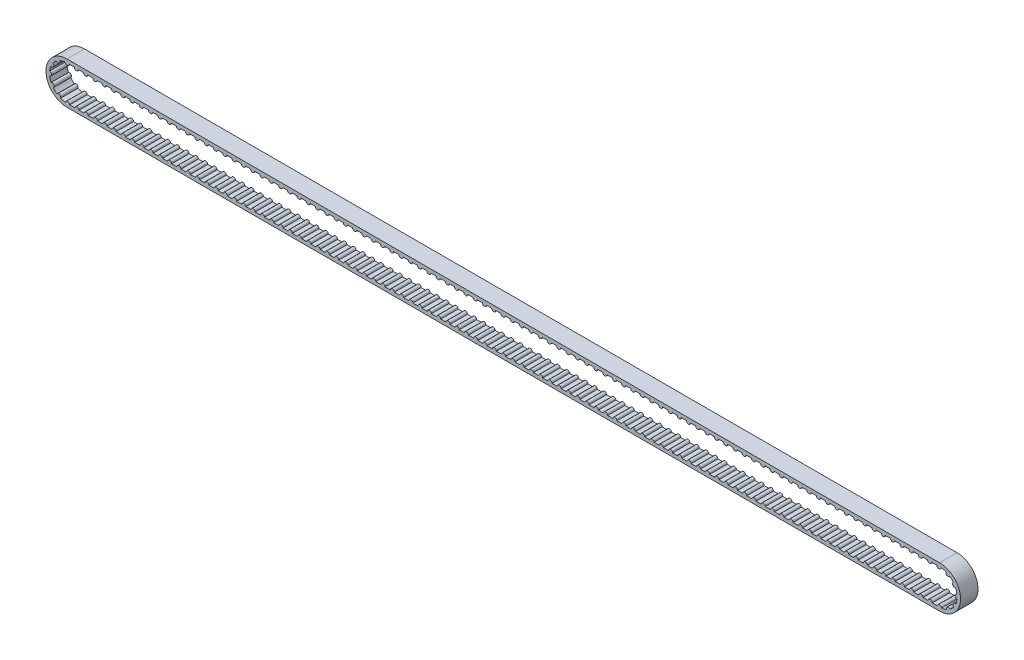
from build123d import *

# Parameters (mm, degrees)
BOSS_EXTRUDE2_DEPTH = 6
BOSS_EXTRUDE4_DEPTH = 6
CRVPATTERN7_DEPTH   = 6


# Read off the part's stored shape, not the designer's step: CrvPattern7
with BuildPart() as part:
    # Sketch1 → Boss-Extrude2 (new body)
    with BuildSketch(Plane.XY):
        with BuildLine():
            Line((0, 7.2), (300, 7.2))
            ThreePointArc((300, 7.2), (307.2, 0), (300, -7.2))
            Line((300, -7.2), (0, -7.2))
            ThreePointArc((0, -7.2), (-7.2, 0), (0, 7.2))
        make_face()
        with BuildLine():
            Line((0, 6), (300, 6))
            ThreePointArc((300, 6), (306, 0), (300, -6))
            Line((300, -6), (0, -6))
            ThreePointArc((0, -6), (-6, 0), (0, 6))
        make_face(mode=Mode.SUBTRACT)
    extrude(amount=BOSS_EXTRUDE2_DEPTH)

    # Sketch4 → Boss-Extrude4 (add)
    with BuildSketch(Plane.XY.offset(6)):
        with BuildLine():
            Line((50.349238174, 6), (51.749238174, 6))
            ThreePointArc((51.749238174, 6), (51.049238174, 5.3), (50.349238174, 6))
        make_face()
    extrude(amount=-BOSS_EXTRUDE4_DEPTH)

    # CrvPattern7 outline → CrvPattern7 (add)
    with BuildSketch(Plane.XY):
        with BuildLine():
            Line((54.937733733, 6), (53.537733733, 6))
            ThreePointArc((53.537733733, 6), (54.237733733, 5.3), (54.937733733, 6))
        make_face()
        with BuildLine():
            Line((48.560742615, 6), (47.160742615, 6))
            ThreePointArc((47.160742615, 6), (47.860742615, 5.3), (48.560742615, 6))
        make_face()
        with BuildLine():
            Line((45.372247055, 6), (43.972247055, 6))
            ThreePointArc((43.972247055, 6), (44.672247055, 5.3), (45.372247055, 6))
        make_face()
        with BuildLine():
            Line((42.183751496, 6), (40.783751496, 6))
            ThreePointArc((40.783751496, 6), (41.483751496, 5.3), (42.183751496, 6))
        make_face()
        with BuildLine():
            Line((38.995255937, 6), (37.595255937, 6))
            ThreePointArc((37.595255937, 6), (38.295255937, 5.3), (38.995255937, 6))
        make_face()
        with BuildLine():
            Line((35.806760378, 6), (34.406760378, 6))
            ThreePointArc((34.406760378, 6), (35.106760378, 5.3), (35.806760378, 6))
        make_face()
        with BuildLine():
            Line((32.618264819, 6), (31.218264819, 6))
            ThreePointArc((31.218264819, 6), (31.918264819, 5.3), (32.618264819, 6))
        make_face()
        with BuildLine():
            Line((29.429769259, 6), (28.029769259, 6))
            ThreePointArc((28.029769259, 6), (28.729769259, 5.3), (29.429769259, 6))
        make_face()
        with BuildLine():
            Line((26.2412737, 6), (24.8412737, 6))
            ThreePointArc((24.8412737, 6), (25.5412737, 5.3), (26.2412737, 6))
        make_face()
        with BuildLine():
            Line((23.052778141, 6), (21.652778141, 6))
            ThreePointArc((21.652778141, 6), (22.352778141, 5.3), (23.052778141, 6))
        make_face()
        with BuildLine():
            Line((19.864282582, 6), (18.464282582, 6))
            ThreePointArc((18.464282582, 6), (19.164282582, 5.3), (19.864282582, 6))
        make_face()
        with BuildLine():
            Line((16.675787022, 6), (15.275787022, 6))
            ThreePointArc((15.275787022, 6), (15.975787022, 5.3), (16.675787022, 6))
        make_face()
        with BuildLine():
            Line((13.487291463, 6), (12.087291463, 6))
            ThreePointArc((12.087291463, 6), (12.787291463, 5.3), (13.487291463, 6))
        make_face()
        with BuildLine():
            Line((10.298795904, 6), (8.898795904, 6))
            ThreePointArc((8.898795904, 6), (9.598795904, 5.3), (10.298795904, 6))
        make_face()
        with BuildLine():
            Line((7.110300345, 6), (5.710300345, 6))
            ThreePointArc((5.710300345, 6), (6.410300345, 5.3), (7.110300345, 6))
        make_face()
        with BuildLine():
            Line((3.921804786, 6), (2.521804786, 6))
            ThreePointArc((2.521804786, 6), (3.221804786, 5.3), (3.921804786, 6))
        make_face()
        with BuildLine():
            ThreePointArc((0, 6), (-0.333369891, 5.990731551), (-0.665709841, 5.962954839))
            ThreePointArc((-0.665709841, 5.962954839), (0.051838299, 5.300245276), (0.733309226, 6))
            Line((0.733309226, 6), (0, 6))
        make_face()
        with BuildLine():
            ThreePointArc((-2.386875705, 5.504800121), (-3.011764762, 5.189342253), (-3.595660354, 4.803251671))
            ThreePointArc((-3.595660354, 4.803251671), (-2.660392206, 4.58391899), (-2.386875705, 5.504800121))
        make_face()
        with BuildLine():
            ThreePointArc((-4.847284913, 3.536075363), (-5.226136079, 2.947456816), (-5.533853726, 2.318720107))
            ThreePointArc((-5.533853726, 2.318720107), (-4.616420203, 2.603586855), (-4.847284913, 3.536075363))
        make_face()
        with BuildLine():
            ThreePointArc((-5.970719949, 0.592033183), (-5.999038805, -0.107393756), (-5.945704077, -0.805358946))
            ThreePointArc((-5.945704077, -0.805358946), (-5.299150944, -0.094864484), (-5.970719949, 0.592033183))
        make_face()
        with BuildLine():
            ThreePointArc((-5.447315879, -2.515303107), (-5.11729154, -3.132623069), (-4.717615178, -3.707304551))
            ThreePointArc((-4.717615178, -3.707304551), (-4.520274194, -2.767150378), (-5.447315879, -2.515303107))
        make_face()
        with BuildLine():
            ThreePointArc((-3.421437585, -4.928870545), (-2.824097096, -5.293814843), (-2.188317508, -5.586704439))
            ThreePointArc((-2.188317508, -5.586704439), (-2.494619101, -4.676203111), (-3.421437585, -4.928870545))
        make_face()
        with BuildLine():
            Line((0, -6), (0.948108207, -6))
            ThreePointArc((0.948108207, -6), (0.25662171, -5.300051773), (-0.451684708, -5.982974254))
            ThreePointArc((-0.451684708, -5.982974254), (-0.226002739, -5.995742053), (0, -6))
        make_face()
        with BuildLine():
            Line((2.736603767, -6), (4.136603767, -6))
            ThreePointArc((4.136603767, -6), (3.436603767, -5.3), (2.736603767, -6))
        make_face()
        with BuildLine():
            Line((5.925099326, -6), (7.325099326, -6))
            ThreePointArc((7.325099326, -6), (6.625099326, -5.3), (5.925099326, -6))
        make_face()
        with BuildLine():
            Line((9.113594885, -6), (10.513594885, -6))
            ThreePointArc((10.513594885, -6), (9.813594885, -5.3), (9.113594885, -6))
        make_face()
        with BuildLine():
            Line((12.302090444, -6), (13.702090444, -6))
            ThreePointArc((13.702090444, -6), (13.002090444, -5.3), (12.302090444, -6))
        make_face()
        with BuildLine():
            Line((15.490586003, -6), (16.890586003, -6))
            ThreePointArc((16.890586003, -6), (16.190586003, -5.3), (15.490586003, -6))
        make_face()
        with BuildLine():
            Line((18.679081563, -6), (20.079081563, -6))
            ThreePointArc((20.079081563, -6), (19.379081563, -5.3), (18.679081563, -6))
        make_face()
        with BuildLine():
            Line((21.867577122, -6), (23.267577122, -6))
            ThreePointArc((23.267577122, -6), (22.567577122, -5.3), (21.867577122, -6))
        make_face()
        with BuildLine():
            Line((25.056072681, -6), (26.456072681, -6))
            ThreePointArc((26.456072681, -6), (25.756072681, -5.3), (25.056072681, -6))
        make_face()
        with BuildLine():
            Line((28.24456824, -6), (29.64456824, -6))
            ThreePointArc((29.64456824, -6), (28.94456824, -5.3), (28.24456824, -6))
        make_face()
        with BuildLine():
            Line((31.4330638, -6), (32.8330638, -6))
            ThreePointArc((32.8330638, -6), (32.1330638, -5.3), (31.4330638, -6))
        make_face()
        with BuildLine():
            Line((34.621559359, -6), (36.021559359, -6))
            ThreePointArc((36.021559359, -6), (35.321559359, -5.3), (34.621559359, -6))
        make_face()
        with BuildLine():
            Line((37.810054918, -6), (39.210054918, -6))
            ThreePointArc((39.210054918, -6), (38.510054918, -5.3), (37.810054918, -6))
        make_face()
        with BuildLine():
            Line((40.998550477, -6), (42.398550477, -6))
            ThreePointArc((42.398550477, -6), (41.698550477, -5.3), (40.998550477, -6))
        make_face()
        with BuildLine():
            Line((44.187046036, -6), (45.587046036, -6))
            ThreePointArc((45.587046036, -6), (44.887046036, -5.3), (44.187046036, -6))
        make_face()
        with BuildLine():
            Line((47.375541596, -6), (48.775541596, -6))
            ThreePointArc((48.775541596, -6), (48.075541596, -5.3), (47.375541596, -6))
        make_face()
        with BuildLine():
            Line((50.564037155, -6), (51.964037155, -6))
            ThreePointArc((51.964037155, -6), (51.264037155, -5.3), (50.564037155, -6))
        make_face()
        with BuildLine():
            Line((53.752532714, -6), (55.152532714, -6))
            ThreePointArc((55.152532714, -6), (54.452532714, -5.3), (53.752532714, -6))
        make_face()
        with BuildLine():
            Line((56.941028273, -6), (58.341028273, -6))
            ThreePointArc((58.341028273, -6), (57.641028273, -5.3), (56.941028273, -6))
        make_face()
        with BuildLine():
            Line((60.129523832, -6), (61.529523832, -6))
            ThreePointArc((61.529523832, -6), (60.829523832, -5.3), (60.129523832, -6))
        make_face()
        with BuildLine():
            Line((63.318019392, -6), (64.718019392, -6))
            ThreePointArc((64.718019392, -6), (64.018019392, -5.3), (63.318019392, -6))
        make_face()
        with BuildLine():
            Line((66.506514951, -6), (67.906514951, -6))
            ThreePointArc((67.906514951, -6), (67.206514951, -5.3), (66.506514951, -6))
        make_face()
        with BuildLine():
            Line((69.69501051, -6), (71.09501051, -6))
            ThreePointArc((71.09501051, -6), (70.39501051, -5.3), (69.69501051, -6))
        make_face()
        with BuildLine():
            Line((72.883506069, -6), (74.283506069, -6))
            ThreePointArc((74.283506069, -6), (73.583506069, -5.3), (72.883506069, -6))
        make_face()
        with BuildLine():
            Line((76.072001629, -6), (77.472001629, -6))
            ThreePointArc((77.472001629, -6), (76.772001629, -5.3), (76.072001629, -6))
        make_face()
        with BuildLine():
            Line((79.260497188, -6), (80.660497188, -6))
            ThreePointArc((80.660497188, -6), (79.960497188, -5.3), (79.260497188, -6))
        make_face()
        with BuildLine():
            Line((82.448992747, -6), (83.848992747, -6))
            ThreePointArc((83.848992747, -6), (83.148992747, -5.3), (82.448992747, -6))
        make_face()
        with BuildLine():
            Line((85.637488306, -6), (87.037488306, -6))
            ThreePointArc((87.037488306, -6), (86.337488306, -5.3), (85.637488306, -6))
        make_face()
        with BuildLine():
            Line((88.825983865, -6), (90.225983865, -6))
            ThreePointArc((90.225983865, -6), (89.525983865, -5.3), (88.825983865, -6))
        make_face()
        with BuildLine():
            Line((92.014479425, -6), (93.414479425, -6))
            ThreePointArc((93.414479425, -6), (92.714479425, -5.3), (92.014479425, -6))
        make_face()
        with BuildLine():
            Line((95.202974984, -6), (96.602974984, -6))
            ThreePointArc((96.602974984, -6), (95.902974984, -5.3), (95.202974984, -6))
        make_face()
        with BuildLine():
            Line((98.391470543, -6), (99.791470543, -6))
            ThreePointArc((99.791470543, -6), (99.091470543, -5.3), (98.391470543, -6))
        make_face()
        with BuildLine():
            Line((101.579966102, -6), (102.979966102, -6))
            ThreePointArc((102.979966102, -6), (102.279966102, -5.3), (101.579966102, -6))
        make_face()
        with BuildLine():
            Line((104.768461661, -6), (106.168461661, -6))
            ThreePointArc((106.168461661, -6), (105.468461661, -5.3), (104.768461661, -6))
        make_face()
        with BuildLine():
            Line((107.956957221, -6), (109.356957221, -6))
            ThreePointArc((109.356957221, -6), (108.656957221, -5.3), (107.956957221, -6))
        make_face()
        with BuildLine():
            Line((111.14545278, -6), (112.54545278, -6))
            ThreePointArc((112.54545278, -6), (111.84545278, -5.3), (111.14545278, -6))
        make_face()
        with BuildLine():
            Line((114.333948339, -6), (115.733948339, -6))
            ThreePointArc((115.733948339, -6), (115.033948339, -5.3), (114.333948339, -6))
        make_face()
        with BuildLine():
            Line((117.522443898, -6), (118.922443898, -6))
            ThreePointArc((118.922443898, -6), (118.222443898, -5.3), (117.522443898, -6))
        make_face()
        with BuildLine():
            Line((120.710939458, -6), (122.110939458, -6))
            ThreePointArc((122.110939458, -6), (121.410939458, -5.3), (120.710939458, -6))
        make_face()
        with BuildLine():
            Line((123.899435017, -6), (125.299435017, -6))
            ThreePointArc((125.299435017, -6), (124.599435017, -5.3), (123.899435017, -6))
        make_face()
        with BuildLine():
            Line((127.087930576, -6), (128.487930576, -6))
            ThreePointArc((128.487930576, -6), (127.787930576, -5.3), (127.087930576, -6))
        make_face()
        with BuildLine():
            Line((130.276426135, -6), (131.676426135, -6))
            ThreePointArc((131.676426135, -6), (130.976426135, -5.3), (130.276426135, -6))
        make_face()
        with BuildLine():
            Line((133.464921694, -6), (134.864921694, -6))
            ThreePointArc((134.864921694, -6), (134.164921694, -5.3), (133.464921694, -6))
        make_face()
        with BuildLine():
            Line((136.653417254, -6), (138.053417254, -6))
            ThreePointArc((138.053417254, -6), (137.353417254, -5.3), (136.653417254, -6))
        make_face()
        with BuildLine():
            Line((139.841912813, -6), (141.241912813, -6))
            ThreePointArc((141.241912813, -6), (140.541912813, -5.3), (139.841912813, -6))
        make_face()
        with BuildLine():
            Line((143.030408372, -6), (144.430408372, -6))
            ThreePointArc((144.430408372, -6), (143.730408372, -5.3), (143.030408372, -6))
        make_face()
        with BuildLine():
            Line((146.218903931, -6), (147.618903931, -6))
            ThreePointArc((147.618903931, -6), (146.918903931, -5.3), (146.218903931, -6))
        make_face()
        with BuildLine():
            Line((149.407399491, -6), (150.807399491, -6))
            ThreePointArc((150.807399491, -6), (150.107399491, -5.3), (149.407399491, -6))
        make_face()
        with BuildLine():
            Line((152.59589505, -6), (153.99589505, -6))
            ThreePointArc((153.99589505, -6), (153.29589505, -5.3), (152.59589505, -6))
        make_face()
        with BuildLine():
            Line((155.784390609, -6), (157.184390609, -6))
            ThreePointArc((157.184390609, -6), (156.484390609, -5.3), (155.784390609, -6))
        make_face()
        with BuildLine():
            Line((158.972886168, -6), (160.372886168, -6))
            ThreePointArc((160.372886168, -6), (159.672886168, -5.3), (158.972886168, -6))
        make_face()
        with BuildLine():
            Line((162.161381727, -6), (163.561381727, -6))
            ThreePointArc((163.561381727, -6), (162.861381727, -5.3), (162.161381727, -6))
        make_face()
        with BuildLine():
            Line((165.349877287, -6), (166.749877287, -6))
            ThreePointArc((166.749877287, -6), (166.049877287, -5.3), (165.349877287, -6))
        make_face()
        with BuildLine():
            Line((168.538372846, -6), (169.938372846, -6))
            ThreePointArc((169.938372846, -6), (169.238372846, -5.3), (168.538372846, -6))
        make_face()
        with BuildLine():
            Line((171.726868405, -6), (173.126868405, -6))
            ThreePointArc((173.126868405, -6), (172.426868405, -5.3), (171.726868405, -6))
        make_face()
        with BuildLine():
            Line((174.915363964, -6), (176.315363964, -6))
            ThreePointArc((176.315363964, -6), (175.615363964, -5.3), (174.915363964, -6))
        make_face()
        with BuildLine():
            Line((178.103859523, -6), (179.503859523, -6))
            ThreePointArc((179.503859523, -6), (178.803859523, -5.3), (178.103859523, -6))
        make_face()
        with BuildLine():
            Line((181.292355083, -6), (182.692355083, -6))
            ThreePointArc((182.692355083, -6), (181.992355083, -5.3), (181.292355083, -6))
        make_face()
        with BuildLine():
            Line((184.480850642, -6), (185.880850642, -6))
            ThreePointArc((185.880850642, -6), (185.180850642, -5.3), (184.480850642, -6))
        make_face()
        with BuildLine():
            Line((187.669346201, -6), (189.069346201, -6))
            ThreePointArc((189.069346201, -6), (188.369346201, -5.3), (187.669346201, -6))
        make_face()
        with BuildLine():
            Line((190.85784176, -6), (192.25784176, -6))
            ThreePointArc((192.25784176, -6), (191.55784176, -5.3), (190.85784176, -6))
        make_face()
        with BuildLine():
            Line((194.04633732, -6), (195.44633732, -6))
            ThreePointArc((195.44633732, -6), (194.74633732, -5.3), (194.04633732, -6))
        make_face()
        with BuildLine():
            Line((197.234832879, -6), (198.634832879, -6))
            ThreePointArc((198.634832879, -6), (197.934832879, -5.3), (197.234832879, -6))
        make_face()
        with BuildLine():
            Line((200.423328438, -6), (201.823328438, -6))
            ThreePointArc((201.823328438, -6), (201.123328438, -5.3), (200.423328438, -6))
        make_face()
        with BuildLine():
            Line((203.611823997, -6), (205.011823997, -6))
            ThreePointArc((205.011823997, -6), (204.311823997, -5.3), (203.611823997, -6))
        make_face()
        with BuildLine():
            Line((206.800319556, -6), (208.200319556, -6))
            ThreePointArc((208.200319556, -6), (207.500319556, -5.3), (206.800319556, -6))
        make_face()
        with BuildLine():
            Line((209.988815116, -6), (211.388815116, -6))
            ThreePointArc((211.388815116, -6), (210.688815116, -5.3), (209.988815116, -6))
        make_face()
        with BuildLine():
            Line((213.177310675, -6), (214.577310675, -6))
            ThreePointArc((214.577310675, -6), (213.877310675, -5.3), (213.177310675, -6))
        make_face()
        with BuildLine():
            Line((216.365806234, -6), (217.765806234, -6))
            ThreePointArc((217.765806234, -6), (217.065806234, -5.3), (216.365806234, -6))
        make_face()
        with BuildLine():
            Line((219.554301793, -6), (220.954301793, -6))
            ThreePointArc((220.954301793, -6), (220.254301793, -5.3), (219.554301793, -6))
        make_face()
        with BuildLine():
            Line((222.742797352, -6), (224.142797352, -6))
            ThreePointArc((224.142797352, -6), (223.442797352, -5.3), (222.742797352, -6))
        make_face()
        with BuildLine():
            Line((225.931292912, -6), (227.331292912, -6))
            ThreePointArc((227.331292912, -6), (226.631292912, -5.3), (225.931292912, -6))
        make_face()
        with BuildLine():
            Line((229.119788471, -6), (230.519788471, -6))
            ThreePointArc((230.519788471, -6), (229.819788471, -5.3), (229.119788471, -6))
        make_face()
        with BuildLine():
            Line((232.30828403, -6), (233.70828403, -6))
            ThreePointArc((233.70828403, -6), (233.00828403, -5.3), (232.30828403, -6))
        make_face()
        with BuildLine():
            Line((235.496779589, -6), (236.896779589, -6))
            ThreePointArc((236.896779589, -6), (236.196779589, -5.3), (235.496779589, -6))
        make_face()
        with BuildLine():
            Line((238.685275149, -6), (240.085275149, -6))
            ThreePointArc((240.085275149, -6), (239.385275149, -5.3), (238.685275149, -6))
        make_face()
        with BuildLine():
            Line((241.873770708, -6), (243.273770708, -6))
            ThreePointArc((243.273770708, -6), (242.573770708, -5.3), (241.873770708, -6))
        make_face()
        with BuildLine():
            Line((245.062266267, -6), (246.462266267, -6))
            ThreePointArc((246.462266267, -6), (245.762266267, -5.3), (245.062266267, -6))
        make_face()
        with BuildLine():
            Line((248.250761826, -6), (249.650761826, -6))
            ThreePointArc((249.650761826, -6), (248.950761826, -5.3), (248.250761826, -6))
        make_face()
        with BuildLine():
            Line((251.439257385, -6), (252.839257385, -6))
            ThreePointArc((252.839257385, -6), (252.139257385, -5.3), (251.439257385, -6))
        make_face()
        with BuildLine():
            Line((254.627752945, -6), (256.027752945, -6))
            ThreePointArc((256.027752945, -6), (255.327752945, -5.3), (254.627752945, -6))
        make_face()
        with BuildLine():
            Line((257.816248504, -6), (259.216248504, -6))
            ThreePointArc((259.216248504, -6), (258.516248504, -5.3), (257.816248504, -6))
        make_face()
        with BuildLine():
            Line((261.004744063, -6), (262.404744063, -6))
            ThreePointArc((262.404744063, -6), (261.704744063, -5.3), (261.004744063, -6))
        make_face()
        with BuildLine():
            Line((264.193239622, -6), (265.593239622, -6))
            ThreePointArc((265.593239622, -6), (264.893239622, -5.3), (264.193239622, -6))
        make_face()
        with BuildLine():
            Line((267.381735181, -6), (268.781735181, -6))
            ThreePointArc((268.781735181, -6), (268.081735181, -5.3), (267.381735181, -6))
        make_face()
        with BuildLine():
            Line((270.570230741, -6), (271.970230741, -6))
            ThreePointArc((271.970230741, -6), (271.270230741, -5.3), (270.570230741, -6))
        make_face()
        with BuildLine():
            Line((273.7587263, -6), (275.1587263, -6))
            ThreePointArc((275.1587263, -6), (274.4587263, -5.3), (273.7587263, -6))
        make_face()
        with BuildLine():
            Line((276.947221859, -6), (278.347221859, -6))
            ThreePointArc((278.347221859, -6), (277.647221859, -5.3), (276.947221859, -6))
        make_face()
        with BuildLine():
            Line((280.135717418, -6), (281.535717418, -6))
            ThreePointArc((281.535717418, -6), (280.835717418, -5.3), (280.135717418, -6))
        make_face()
        with BuildLine():
            Line((283.324212978, -6), (284.724212978, -6))
            ThreePointArc((284.724212978, -6), (284.024212978, -5.3), (283.324212978, -6))
        make_face()
        with BuildLine():
            Line((286.512708537, -6), (287.912708537, -6))
            ThreePointArc((287.912708537, -6), (287.212708537, -5.3), (286.512708537, -6))
        make_face()
        with BuildLine():
            Line((289.701204096, -6), (291.101204096, -6))
            ThreePointArc((291.101204096, -6), (290.401204096, -5.3), (289.701204096, -6))
        make_face()
        with BuildLine():
            Line((292.889699655, -6), (294.289699655, -6))
            ThreePointArc((294.289699655, -6), (293.589699655, -5.3), (292.889699655, -6))
        make_face()
        with BuildLine():
            Line((296.078195214, -6), (297.478195214, -6))
            ThreePointArc((297.478195214, -6), (296.778195214, -5.3), (296.078195214, -6))
        make_face()
        with BuildLine():
            ThreePointArc((300, -6), (300.333369891, -5.990731551), (300.665709841, -5.962954839))
            ThreePointArc((300.665709841, -5.962954839), (299.948161701, -5.300245276), (299.266690774, -6))
            Line((299.266690774, -6), (300, -6))
        make_face()
        with BuildLine():
            ThreePointArc((302.386875705, -5.504800121), (303.011764762, -5.189342253), (303.595660354, -4.803251671))
            ThreePointArc((303.595660354, -4.803251671), (302.660392206, -4.58391899), (302.386875705, -5.504800121))
        make_face()
        with BuildLine():
            ThreePointArc((304.847284913, -3.536075363), (305.226136079, -2.947456816), (305.533853726, -2.318720107))
            ThreePointArc((305.533853726, -2.318720107), (304.616420203, -2.603586855), (304.847284913, -3.536075363))
        make_face()
        with BuildLine():
            ThreePointArc((305.970719949, -0.592033183), (305.999038805, 0.107393756), (305.945704077, 0.805358946))
            ThreePointArc((305.945704077, 0.805358946), (305.299150944, 0.094864484), (305.970719949, -0.592033183))
        make_face()
        with BuildLine():
            ThreePointArc((305.447315879, 2.515303107), (305.11729154, 3.132623069), (304.717615178, 3.707304551))
            ThreePointArc((304.717615178, 3.707304551), (304.520274194, 2.767150378), (305.447315879, 2.515303107))
        make_face()
        with BuildLine():
            ThreePointArc((303.421437585, 4.928870545), (302.824097096, 5.293814843), (302.188317508, 5.586704439))
            ThreePointArc((302.188317508, 5.586704439), (302.494619101, 4.676203111), (303.421437585, 4.928870545))
        make_face()
        with BuildLine():
            Line((300, 6), (299.051891793, 6))
            ThreePointArc((299.051891793, 6), (299.74337829, 5.300051773), (300.451684708, 5.982974254))
            ThreePointArc((300.451684708, 5.982974254), (300.226002739, 5.995742053), (300, 6))
        make_face()
        with BuildLine():
            Line((297.263396233, 6), (295.863396233, 6))
            ThreePointArc((295.863396233, 6), (296.563396233, 5.3), (297.263396233, 6))
        make_face()
        with BuildLine():
            Line((294.074900674, 6), (292.674900674, 6))
            ThreePointArc((292.674900674, 6), (293.374900674, 5.3), (294.074900674, 6))
        make_face()
        with BuildLine():
            Line((290.886405115, 6), (289.486405115, 6))
            ThreePointArc((289.486405115, 6), (290.186405115, 5.3), (290.886405115, 6))
        make_face()
        with BuildLine():
            Line((287.697909556, 6), (286.297909556, 6))
            ThreePointArc((286.297909556, 6), (286.997909556, 5.3), (287.697909556, 6))
        make_face()
        with BuildLine():
            Line((284.509413997, 6), (283.109413997, 6))
            ThreePointArc((283.109413997, 6), (283.809413997, 5.3), (284.509413997, 6))
        make_face()
        with BuildLine():
            Line((281.320918437, 6), (279.920918437, 6))
            ThreePointArc((279.920918437, 6), (280.620918437, 5.3), (281.320918437, 6))
        make_face()
        with BuildLine():
            Line((278.132422878, 6), (276.732422878, 6))
            ThreePointArc((276.732422878, 6), (277.432422878, 5.3), (278.132422878, 6))
        make_face()
        with BuildLine():
            Line((274.943927319, 6), (273.543927319, 6))
            ThreePointArc((273.543927319, 6), (274.243927319, 5.3), (274.943927319, 6))
        make_face()
        with BuildLine():
            Line((271.75543176, 6), (270.35543176, 6))
            ThreePointArc((270.35543176, 6), (271.05543176, 5.3), (271.75543176, 6))
        make_face()
        with BuildLine():
            Line((268.5669362, 6), (267.1669362, 6))
            ThreePointArc((267.1669362, 6), (267.8669362, 5.3), (268.5669362, 6))
        make_face()
        with BuildLine():
            Line((265.378440641, 6), (263.978440641, 6))
            ThreePointArc((263.978440641, 6), (264.678440641, 5.3), (265.378440641, 6))
        make_face()
        with BuildLine():
            Line((262.189945082, 6), (260.789945082, 6))
            ThreePointArc((260.789945082, 6), (261.489945082, 5.3), (262.189945082, 6))
        make_face()
        with BuildLine():
            Line((259.001449523, 6), (257.601449523, 6))
            ThreePointArc((257.601449523, 6), (258.301449523, 5.3), (259.001449523, 6))
        make_face()
        with BuildLine():
            Line((255.812953964, 6), (254.412953964, 6))
            ThreePointArc((254.412953964, 6), (255.112953964, 5.3), (255.812953964, 6))
        make_face()
        with BuildLine():
            Line((252.624458404, 6), (251.224458404, 6))
            ThreePointArc((251.224458404, 6), (251.924458404, 5.3), (252.624458404, 6))
        make_face()
        with BuildLine():
            Line((249.435962845, 6), (248.035962845, 6))
            ThreePointArc((248.035962845, 6), (248.735962845, 5.3), (249.435962845, 6))
        make_face()
        with BuildLine():
            Line((246.247467286, 6), (244.847467286, 6))
            ThreePointArc((244.847467286, 6), (245.547467286, 5.3), (246.247467286, 6))
        make_face()
        with BuildLine():
            Line((243.058971727, 6), (241.658971727, 6))
            ThreePointArc((241.658971727, 6), (242.358971727, 5.3), (243.058971727, 6))
        make_face()
        with BuildLine():
            Line((239.870476168, 6), (238.470476168, 6))
            ThreePointArc((238.470476168, 6), (239.170476168, 5.3), (239.870476168, 6))
        make_face()
        with BuildLine():
            Line((236.681980608, 6), (235.281980608, 6))
            ThreePointArc((235.281980608, 6), (235.981980608, 5.3), (236.681980608, 6))
        make_face()
        with BuildLine():
            Line((233.493485049, 6), (232.093485049, 6))
            ThreePointArc((232.093485049, 6), (232.793485049, 5.3), (233.493485049, 6))
        make_face()
        with BuildLine():
            Line((230.30498949, 6), (228.90498949, 6))
            ThreePointArc((228.90498949, 6), (229.60498949, 5.3), (230.30498949, 6))
        make_face()
        with BuildLine():
            Line((227.116493931, 6), (225.716493931, 6))
            ThreePointArc((225.716493931, 6), (226.416493931, 5.3), (227.116493931, 6))
        make_face()
        with BuildLine():
            Line((223.927998371, 6), (222.527998371, 6))
            ThreePointArc((222.527998371, 6), (223.227998371, 5.3), (223.927998371, 6))
        make_face()
        with BuildLine():
            Line((220.739502812, 6), (219.339502812, 6))
            ThreePointArc((219.339502812, 6), (220.039502812, 5.3), (220.739502812, 6))
        make_face()
        with BuildLine():
            Line((217.551007253, 6), (216.151007253, 6))
            ThreePointArc((216.151007253, 6), (216.851007253, 5.3), (217.551007253, 6))
        make_face()
        with BuildLine():
            Line((214.362511694, 6), (212.962511694, 6))
            ThreePointArc((212.962511694, 6), (213.662511694, 5.3), (214.362511694, 6))
        make_face()
        with BuildLine():
            Line((211.174016135, 6), (209.774016135, 6))
            ThreePointArc((209.774016135, 6), (210.474016135, 5.3), (211.174016135, 6))
        make_face()
        with BuildLine():
            Line((207.985520575, 6), (206.585520575, 6))
            ThreePointArc((206.585520575, 6), (207.285520575, 5.3), (207.985520575, 6))
        make_face()
        with BuildLine():
            Line((204.797025016, 6), (203.397025016, 6))
            ThreePointArc((203.397025016, 6), (204.097025016, 5.3), (204.797025016, 6))
        make_face()
        with BuildLine():
            Line((201.608529457, 6), (200.208529457, 6))
            ThreePointArc((200.208529457, 6), (200.908529457, 5.3), (201.608529457, 6))
        make_face()
        with BuildLine():
            Line((198.420033898, 6), (197.020033898, 6))
            ThreePointArc((197.020033898, 6), (197.720033898, 5.3), (198.420033898, 6))
        make_face()
        with BuildLine():
            Line((195.231538339, 6), (193.831538339, 6))
            ThreePointArc((193.831538339, 6), (194.531538339, 5.3), (195.231538339, 6))
        make_face()
        with BuildLine():
            Line((192.043042779, 6), (190.643042779, 6))
            ThreePointArc((190.643042779, 6), (191.343042779, 5.3), (192.043042779, 6))
        make_face()
        with BuildLine():
            Line((188.85454722, 6), (187.45454722, 6))
            ThreePointArc((187.45454722, 6), (188.15454722, 5.3), (188.85454722, 6))
        make_face()
        with BuildLine():
            Line((185.666051661, 6), (184.266051661, 6))
            ThreePointArc((184.266051661, 6), (184.966051661, 5.3), (185.666051661, 6))
        make_face()
        with BuildLine():
            Line((182.477556102, 6), (181.077556102, 6))
            ThreePointArc((181.077556102, 6), (181.777556102, 5.3), (182.477556102, 6))
        make_face()
        with BuildLine():
            Line((179.289060542, 6), (177.889060542, 6))
            ThreePointArc((177.889060542, 6), (178.589060542, 5.3), (179.289060542, 6))
        make_face()
        with BuildLine():
            Line((176.100564983, 6), (174.700564983, 6))
            ThreePointArc((174.700564983, 6), (175.400564983, 5.3), (176.100564983, 6))
        make_face()
        with BuildLine():
            Line((172.912069424, 6), (171.512069424, 6))
            ThreePointArc((171.512069424, 6), (172.212069424, 5.3), (172.912069424, 6))
        make_face()
        with BuildLine():
            Line((169.723573865, 6), (168.323573865, 6))
            ThreePointArc((168.323573865, 6), (169.023573865, 5.3), (169.723573865, 6))
        make_face()
        with BuildLine():
            Line((166.535078306, 6), (165.135078306, 6))
            ThreePointArc((165.135078306, 6), (165.835078306, 5.3), (166.535078306, 6))
        make_face()
        with BuildLine():
            Line((163.346582746, 6), (161.946582746, 6))
            ThreePointArc((161.946582746, 6), (162.646582746, 5.3), (163.346582746, 6))
        make_face()
        with BuildLine():
            Line((160.158087187, 6), (158.758087187, 6))
            ThreePointArc((158.758087187, 6), (159.458087187, 5.3), (160.158087187, 6))
        make_face()
        with BuildLine():
            Line((156.969591628, 6), (155.569591628, 6))
            ThreePointArc((155.569591628, 6), (156.269591628, 5.3), (156.969591628, 6))
        make_face()
        with BuildLine():
            Line((153.781096069, 6), (152.381096069, 6))
            ThreePointArc((152.381096069, 6), (153.081096069, 5.3), (153.781096069, 6))
        make_face()
        with BuildLine():
            Line((150.592600509, 6), (149.192600509, 6))
            ThreePointArc((149.192600509, 6), (149.892600509, 5.3), (150.592600509, 6))
        make_face()
        with BuildLine():
            Line((147.40410495, 6), (146.00410495, 6))
            ThreePointArc((146.00410495, 6), (146.70410495, 5.3), (147.40410495, 6))
        make_face()
        with BuildLine():
            Line((144.215609391, 6), (142.815609391, 6))
            ThreePointArc((142.815609391, 6), (143.515609391, 5.3), (144.215609391, 6))
        make_face()
        with BuildLine():
            Line((141.027113832, 6), (139.627113832, 6))
            ThreePointArc((139.627113832, 6), (140.327113832, 5.3), (141.027113832, 6))
        make_face()
        with BuildLine():
            Line((137.838618273, 6), (136.438618273, 6))
            ThreePointArc((136.438618273, 6), (137.138618273, 5.3), (137.838618273, 6))
        make_face()
        with BuildLine():
            Line((134.650122713, 6), (133.250122713, 6))
            ThreePointArc((133.250122713, 6), (133.950122713, 5.3), (134.650122713, 6))
        make_face()
        with BuildLine():
            Line((131.461627154, 6), (130.061627154, 6))
            ThreePointArc((130.061627154, 6), (130.761627154, 5.3), (131.461627154, 6))
        make_face()
        with BuildLine():
            Line((128.273131595, 6), (126.873131595, 6))
            ThreePointArc((126.873131595, 6), (127.573131595, 5.3), (128.273131595, 6))
        make_face()
        with BuildLine():
            Line((125.084636036, 6), (123.684636036, 6))
            ThreePointArc((123.684636036, 6), (124.384636036, 5.3), (125.084636036, 6))
        make_face()
        with BuildLine():
            Line((121.896140477, 6), (120.496140477, 6))
            ThreePointArc((120.496140477, 6), (121.196140477, 5.3), (121.896140477, 6))
        make_face()
        with BuildLine():
            Line((118.707644917, 6), (117.307644917, 6))
            ThreePointArc((117.307644917, 6), (118.007644917, 5.3), (118.707644917, 6))
        make_face()
        with BuildLine():
            Line((115.519149358, 6), (114.119149358, 6))
            ThreePointArc((114.119149358, 6), (114.819149358, 5.3), (115.519149358, 6))
        make_face()
        with BuildLine():
            Line((112.330653799, 6), (110.930653799, 6))
            ThreePointArc((110.930653799, 6), (111.630653799, 5.3), (112.330653799, 6))
        make_face()
        with BuildLine():
            Line((109.14215824, 6), (107.74215824, 6))
            ThreePointArc((107.74215824, 6), (108.44215824, 5.3), (109.14215824, 6))
        make_face()
        with BuildLine():
            Line((105.95366268, 6), (104.55366268, 6))
            ThreePointArc((104.55366268, 6), (105.25366268, 5.3), (105.95366268, 6))
        make_face()
        with BuildLine():
            Line((102.765167121, 6), (101.365167121, 6))
            ThreePointArc((101.365167121, 6), (102.065167121, 5.3), (102.765167121, 6))
        make_face()
        with BuildLine():
            Line((99.576671562, 6), (98.176671562, 6))
            ThreePointArc((98.176671562, 6), (98.876671562, 5.3), (99.576671562, 6))
        make_face()
        with BuildLine():
            Line((96.388176003, 6), (94.988176003, 6))
            ThreePointArc((94.988176003, 6), (95.688176003, 5.3), (96.388176003, 6))
        make_face()
        with BuildLine():
            Line((93.199680444, 6), (91.799680444, 6))
            ThreePointArc((91.799680444, 6), (92.499680444, 5.3), (93.199680444, 6))
        make_face()
        with BuildLine():
            Line((90.011184884, 6), (88.611184884, 6))
            ThreePointArc((88.611184884, 6), (89.311184884, 5.3), (90.011184884, 6))
        make_face()
        with BuildLine():
            Line((86.822689325, 6), (85.422689325, 6))
            ThreePointArc((85.422689325, 6), (86.122689325, 5.3), (86.822689325, 6))
        make_face()
        with BuildLine():
            Line((83.634193766, 6), (82.234193766, 6))
            ThreePointArc((82.234193766, 6), (82.934193766, 5.3), (83.634193766, 6))
        make_face()
        with BuildLine():
            Line((80.445698207, 6), (79.045698207, 6))
            ThreePointArc((79.045698207, 6), (79.745698207, 5.3), (80.445698207, 6))
        make_face()
        with BuildLine():
            Line((77.257202648, 6), (75.857202648, 6))
            ThreePointArc((75.857202648, 6), (76.557202648, 5.3), (77.257202648, 6))
        make_face()
        with BuildLine():
            Line((74.068707088, 6), (72.668707088, 6))
            ThreePointArc((72.668707088, 6), (73.368707088, 5.3), (74.068707088, 6))
        make_face()
        with BuildLine():
            Line((70.880211529, 6), (69.480211529, 6))
            ThreePointArc((69.480211529, 6), (70.180211529, 5.3), (70.880211529, 6))
        make_face()
        with BuildLine():
            Line((67.69171597, 6), (66.29171597, 6))
            ThreePointArc((66.29171597, 6), (66.99171597, 5.3), (67.69171597, 6))
        make_face()
        with BuildLine():
            Line((64.503220411, 6), (63.103220411, 6))
            ThreePointArc((63.103220411, 6), (63.803220411, 5.3), (64.503220411, 6))
        make_face()
        with BuildLine():
            Line((61.314724851, 6), (59.914724851, 6))
            ThreePointArc((59.914724851, 6), (60.614724851, 5.3), (61.314724851, 6))
        make_face()
        with BuildLine():
            Line((58.126229292, 6), (56.726229292, 6))
            ThreePointArc((56.726229292, 6), (57.426229292, 5.3), (58.126229292, 6))
        make_face()
    extrude(amount=CRVPATTERN7_DEPTH)


solid = part.part
